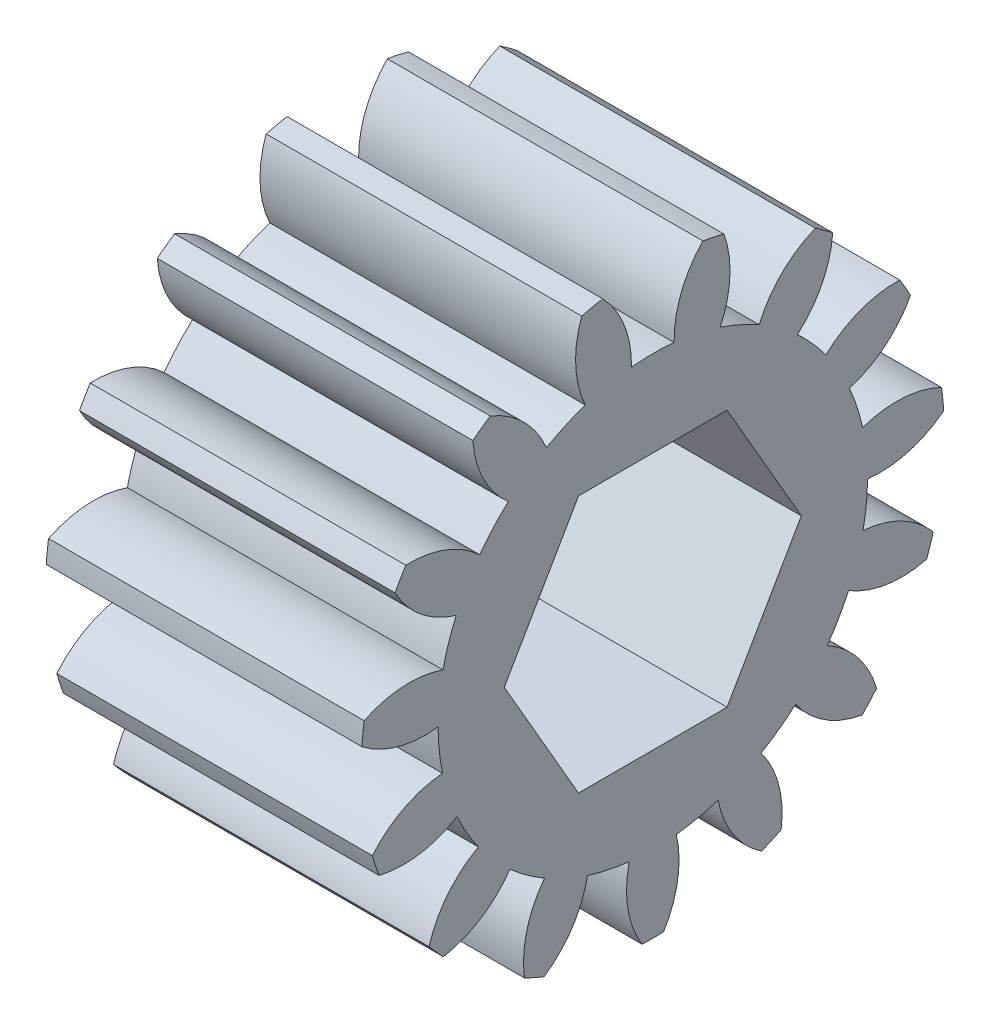
from build123d import *

# Parameters (mm, degrees)
SPUR_START             = -54.751290346
SPUR_GEAR_AI_OUTLINE_R = 4.7625
SPUR_GEAR_AI_DEPTH     = 11.684
CUT_EXTRUDE1_DEPTH     = 45.73825268


# Read off the part's stored shape, not the designer's step: spur gear_ai
with BuildPart() as part:
    # spur gear_ai outline → spur gear_ai (new body)
    with BuildSketch(Plane.YZ.offset(SPUR_START)):
        with BuildLine():
            ThreePointArc((6.265843754, 23.742611923), (6.505460201, 24.059955507), (6.73322633, 24.385908852))
            ThreePointArc((6.73322633, 24.385908852), (5.912883536, 25.630805773), (4.677624003, 26.465589895))
            ThreePointArc((4.677624003, 26.465589895), (5.034990844, 27.171459646), (5.320429206, 27.90935402))
            ThreePointArc((5.320429206, 27.90935402), (6.767344667, 27.549956895), (8.241399844, 27.773322024))
            ThreePointArc((8.241399844, 27.773322024), (8.331225097, 28.160690604), (8.40672264, 28.551104632))
            ThreePointArc((8.40672264, 28.551104632), (7.150957012, 29.354711085), (5.682953985, 29.614899012))
            ThreePointArc((5.682953985, 29.614899012), (5.722321747, 30.405097306), (5.682953985, 31.1952956))
            ThreePointArc((5.682953985, 31.1952956), (7.150957012, 31.455483527), (8.40672264, 32.25908998))
            ThreePointArc((8.40672264, 32.25908998), (8.331225097, 32.649504008), (8.241399844, 33.036872588))
            ThreePointArc((8.241399844, 33.036872588), (6.767344667, 33.260237716), (5.320429206, 32.900840592))
            ThreePointArc((5.320429206, 32.900840592), (5.034990844, 33.638734965), (4.677624003, 34.344604716))
            ThreePointArc((4.677624003, 34.344604716), (5.912883536, 35.179388839), (6.73322633, 36.42428576))
            ThreePointArc((6.73322633, 36.42428576), (6.505460201, 36.750239104), (6.265843754, 37.067582688))
            ThreePointArc((6.265843754, 37.067582688), (4.82837656, 36.672084633), (3.652733492, 35.755245485))
            ThreePointArc((3.652733492, 35.755245485), (3.091843894, 36.313247297), (2.478269946, 36.812737212))
            ThreePointArc((2.478269946, 36.812737212), (3.26719839, 38.077775771), (3.510273629, 39.548709173))
            ThreePointArc((3.510273629, 39.548709173), (3.169621747, 39.75384154), (2.821645965, 39.94628854))
            ThreePointArc((2.821645965, 39.94628854), (1.669317892, 39.000312507), (0.968226585, 37.684561153))
            ThreePointArc((0.968226585, 37.684561153), (0.228868656, 37.966186822), (-0.534819889, 38.172930557))
            ThreePointArc((-0.534819889, 38.172930557), (-0.328635429, 39.649486893), (-0.704857663, 41.092119028))
            ThreePointArc((-0.704857663, 41.092119028), (-1.099493493, 41.140961166), (-1.495660434, 41.175235748))
            ThreePointArc((-1.495660434, 41.175235748), (-2.163601395, 39.842349587), (-2.268915885, 38.35519139))
            ThreePointArc((-2.268915885, 38.35519139), (-3.058900442, 38.311745278), (-3.840654895, 38.189994964))
            ThreePointArc((-3.840654895, 38.189994964), (-4.252865586, 39.622759072), (-5.18333305, 40.787645738))
            ThreePointArc((-5.18333305, 40.787645738), (-5.563716707, 40.671752399), (-5.939573945, 40.541928176))
            ThreePointArc((-5.939573945, 40.541928176), (-6.007634734, 39.052600014), (-5.498962575, 37.651178136))
            ThreePointArc((-5.498962575, 37.651178136), (-6.202978253, 37.290172471), (-6.867626169, 36.860979842))
            ThreePointArc((-6.867626169, 36.860979842), (-7.826957037, 38.002213793), (-9.150783454, 38.687935502))
            ThreePointArc((-9.150783454, 38.687935502), (-9.451143149, 38.427345697), (-9.741701553, 38.155870456))
            ThreePointArc((-9.741701553, 38.155870456), (-9.19811384, 36.767618662), (-8.16340907, 35.694251677))
            ThreePointArc((-8.16340907, 35.694251677), (-8.659725162, 35.078107619), (-9.092342877, 34.41568398))
            ThreePointArc((-9.092342877, 34.41568398), (-10.4329169, 35.068058055), (-11.921200656, 35.156047294))
            ThreePointArc((-11.921200656, 35.156047294), (-12.089601468, 34.795819368), (-12.24462085, 34.429633645))
            ThreePointArc((-12.24462085, 34.429633645), (-11.18337589, 33.382499566), (-9.801548363, 32.822782378))
            ThreePointArc((-9.801548363, 32.822782378), (-10.004347308, 32.05803683), (-10.13013129, 31.276921247))
            ThreePointArc((-10.13013129, 31.276921247), (-11.62015104, 31.327634041), (-13.015554353, 30.802676673))
            ThreePointArc((-13.015554353, 30.802676673), (-13.022878253, 30.405097306), (-13.015554353, 30.007517939))
            ThreePointArc((-13.015554353, 30.007517939), (-11.62015104, 29.48256057), (-10.13013129, 29.533273365))
            ThreePointArc((-10.13013129, 29.533273365), (-10.004347308, 28.752157782), (-9.801548363, 27.987412234))
            ThreePointArc((-9.801548363, 27.987412234), (-11.18337589, 27.427695046), (-12.24462085, 26.380560967))
            ThreePointArc((-12.24462085, 26.380560967), (-12.089601468, 26.014375244), (-11.921200656, 25.654147317))
            ThreePointArc((-11.921200656, 25.654147317), (-10.4329169, 25.742136557), (-9.092342877, 26.394510632))
            ThreePointArc((-9.092342877, 26.394510632), (-8.659725162, 25.732086993), (-8.16340907, 25.115942934))
            ThreePointArc((-8.16340907, 25.115942934), (-9.19811384, 24.04257595), (-9.741701553, 22.654324156))
            ThreePointArc((-9.741701553, 22.654324156), (-9.451143149, 22.382848915), (-9.150783454, 22.12225911))
            ThreePointArc((-9.150783454, 22.12225911), (-7.826957037, 22.807980819), (-6.867626169, 23.94921477))
            ThreePointArc((-6.867626169, 23.94921477), (-6.202978253, 23.520022141), (-5.498962575, 23.159016476))
            ThreePointArc((-5.498962575, 23.159016476), (-6.007634734, 21.757594598), (-5.939573945, 20.268266436))
            ThreePointArc((-5.939573945, 20.268266436), (-5.563716707, 20.138442212), (-5.18333305, 20.022548874))
            ThreePointArc((-5.18333305, 20.022548874), (-4.252865586, 21.187435539), (-3.840654895, 22.620199648))
            ThreePointArc((-3.840654895, 22.620199648), (-3.058900442, 22.498449333), (-2.268915885, 22.455003221))
            ThreePointArc((-2.268915885, 22.455003221), (-2.163601395, 20.967845024), (-1.495660434, 19.634958864))
            ThreePointArc((-1.495660434, 19.634958864), (-1.099493492, 19.669233445), (-0.704857663, 19.718075584))
            ThreePointArc((-0.704857663, 19.718075584), (-0.328635429, 21.160707719), (-0.534819889, 22.637264055))
            ThreePointArc((-0.534819889, 22.637264055), (0.228868655, 22.84400779), (0.968226585, 23.125633458))
            ThreePointArc((0.968226585, 23.125633458), (1.669317892, 21.809882105), (2.821645965, 20.863906072))
            ThreePointArc((2.821645965, 20.863906072), (3.169621747, 21.056353072), (3.510273629, 21.261485438))
            ThreePointArc((3.510273629, 21.261485438), (3.26719839, 22.73241884), (2.478269946, 23.997457399))
            ThreePointArc((2.478269946, 23.997457399), (3.091843894, 24.496947314), (3.652733492, 25.054949127))
            ThreePointArc((3.652733492, 25.054949127), (4.82837656, 24.138109979), (6.265843754, 23.742611923))
        make_face()
        with Locations((-2.227878253, 30.405097306)):
            Circle(SPUR_GEAR_AI_OUTLINE_R, mode=Mode.SUBTRACT)
    extrude(amount=SPUR_GEAR_AI_DEPTH)

    # Sketch1 → Cut-Extrude1 (cut, through all)
    with BuildSketch(Plane(origin=(-43.067290346, 0, 0), x_dir=(0, 0, -1), z_dir=(1, 0, 0))):
        Polygon((-27.655466649, 2.534621747), (-33.154727963, 2.534621747), (-35.90435862, -2.227878253), (-33.154727963, -6.990378253), (-27.655466649, -6.990378253), (-24.905835992, -2.227878253), align=None)
    extrude(amount=-CUT_EXTRUDE1_DEPTH, mode=Mode.SUBTRACT)


solid = part.part
